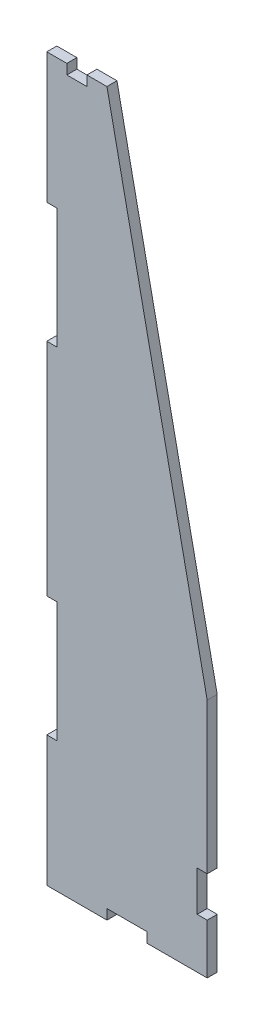
from build123d import *

# Parameters (mm, degrees)
BOSS_EXTRUDE3_DEPTH = 6.35
SKETCH2_W           = 12.7
SKETCH2_H           = 6.35
SKETCH2_W_2         = 6.35
SKETCH2_H_2         = 76.2
SKETCH2_W_3         = 25.4
SKETCH2_H_3         = 25.4
CUT_EXTRUDE1_DEPTH  = 770.479452425


with BuildPart() as part:
    # Sketch1 → Boss-Extrude3 (new body)
    with BuildSketch(Plane.XY):
        Polygon((359.319883673, 642.86985555), (422.819883673, 338.06985555), (422.819883673, 185.66985555), (321.219883673, 185.66985555), (321.219883673, 642.86985555), align=None)
    extrude(amount=BOSS_EXTRUDE3_DEPTH)

    # Sketch2 → Cut-Extrude1 (cut, through all)
    with BuildSketch(Plane.XY.offset(6.35)):
        with Locations((340.269883673, 639.69485555)):
            Rectangle(SKETCH2_W, SKETCH2_H)
        with Locations((324.394883673, 522.21985555)):
            Rectangle(SKETCH2_W_2, SKETCH2_H_2)
        with Locations((324.394883673, 306.31985555)):
            Rectangle(SKETCH2_W_2, SKETCH2_H_2)
        with Locations((372.019883673, 188.84485555)):
            Rectangle(SKETCH2_W_3, SKETCH2_H)
        with Locations((419.644883673, 230.11985555)):
            Rectangle(SKETCH2_W_2, SKETCH2_H_3)
    extrude(amount=-CUT_EXTRUDE1_DEPTH, mode=Mode.SUBTRACT)


solid = part.part
